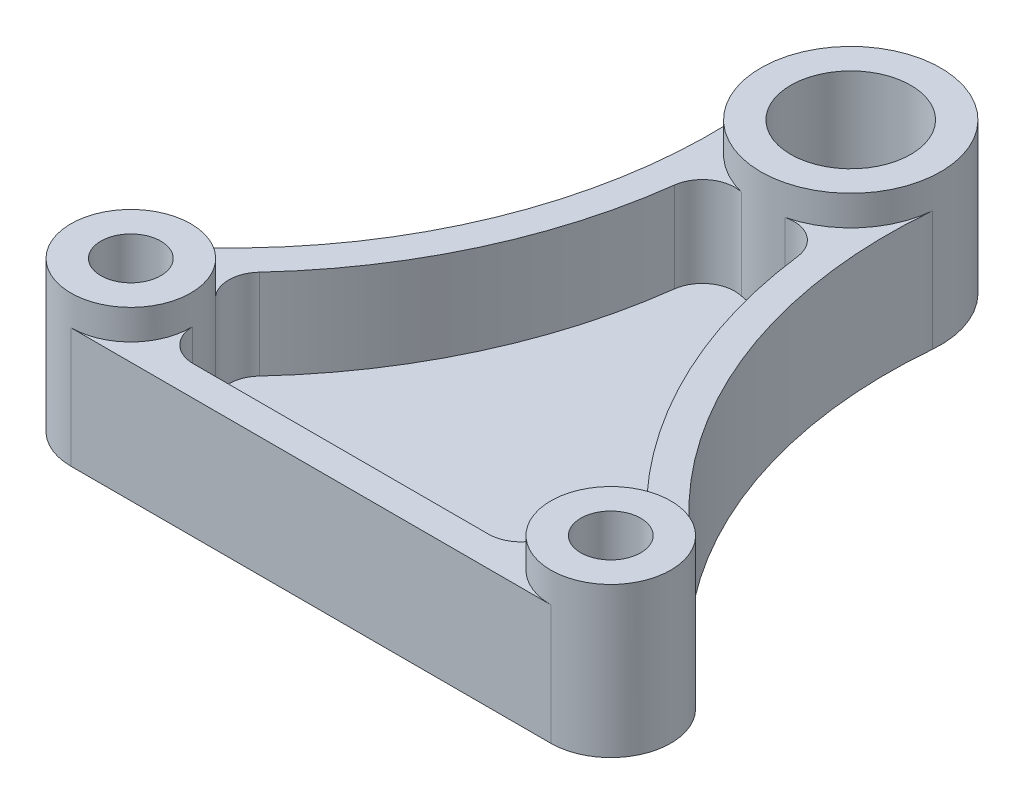
from build123d import *

# Parameters (mm, degrees)
BOSS_EXTRUDE1_DEPTH = 12.7
OUTSIDE_CIRLCES_R   = 9.525
OUTSIDE_CIRLCES_R_2 = 6.35
BOSS_EXTRUDE2_DEPTH = 15.875
SKETCH2_R           = 6.35
SKETCH2_R_2         = 3.175
CUT_EXTRUDE2_DEPTH  = 68.277043819
SHELL1_START        = 3.175
SHELL1_DEPTH        = 9.525
FILLET1_R           = 3.429


# Read off the part's stored shape, not the designer's step: Shell1
with BuildPart() as part:
    # Sketch1 → Boss-Extrude1 (new body)
    with BuildSketch(Plane(origin=(0, 0, 0), x_dir=(1, 0, 0), z_dir=(0, 1, 0))):
        with BuildLine():
            Line((-25.4, -57.15), (25.4, -57.15))
            ThreePointArc((25.4, -57.15), (31.415385717, -52.834117665), (29.253859008, -45.753192024))
            ThreePointArc((29.253859008, -45.753192024), (13.590190704, -25.845719106), (9.487062801, -0.849272876))
            ThreePointArc((9.487062801, -0.849272876), (0, 9.525), (-9.487062801, -0.849272876))
            ThreePointArc((-9.487062801, -0.849272876), (-13.590190704, -25.845719106), (-29.253859008, -45.753192024))
            ThreePointArc((-29.253859008, -45.753192024), (-31.415385717, -52.834117665), (-25.4, -57.15))
        make_face()
    extrude(amount=BOSS_EXTRUDE1_DEPTH)

    # Outside Cirlces → Boss-Extrude2 (add)
    with BuildSketch(Plane(origin=(0, 0, 0), x_dir=(1, 0, 0), z_dir=(0, 1, 0))):
        with Locations(Location((0, 0, 0), (0, 0, 354.884571445))):
            Circle(OUTSIDE_CIRLCES_R)
        with Locations(Location((25.4, -50.8, 0), (0, 0, 270))):
            Circle(OUTSIDE_CIRLCES_R_2)
        with Locations(Location((-25.4, -50.8, 0), (0, 0, 90))):
            Circle(OUTSIDE_CIRLCES_R_2)
    extrude(amount=BOSS_EXTRUDE2_DEPTH)

    # Sketch2 → Cut-Extrude2 (cut, through all)
    with BuildSketch(Plane(origin=(0, 0, 0), x_dir=(1, 0, 0), z_dir=(0, 1, 0))):
        with Locations(Location((0, 0, 0), (0, 0, 270))):
            Circle(SKETCH2_R)
        with Locations(Location((-25.4, -50.8, 0), (0, 0, 270))):
            Circle(SKETCH2_R_2)
        with Locations(Location((25.4, -50.8, 0), (0, 0, 270))):
            Circle(SKETCH2_R_2)
    extrude(amount=CUT_EXTRUDE2_DEPTH, mode=Mode.SUBTRACT)

    # Shell1 outline → Shell1 (cut)
    with BuildSketch(Plane(origin=(0, 0, 0), x_dir=(1, 0, 0), z_dir=(0, 1, 0)).offset(SHELL1_START)):
        with BuildLine():
            ThreePointArc((-23.245193613, -44.826783996), (-19.436053982, -48.61966794), (-19.900738686, -53.975))
            Line((-19.900738686, -53.975), (19.900738686, -53.975))
            ThreePointArc((19.900738686, -53.975), (19.436053982, -48.61966794), (23.245193613, -44.826783996))
            ThreePointArc((23.245193613, -44.826783996), (10.964919098, -27.751584466), (6.1431994, -7.279198179))
            ThreePointArc((6.1431994, -7.279198179), (0, -9.525), (-6.1431994, -7.279198179))
            ThreePointArc((-6.1431994, -7.279198179), (-10.964919098, -27.751584466), (-23.245193613, -44.826783996))
        make_face()
    extrude(amount=SHELL1_DEPTH, mode=Mode.SUBTRACT)

    # Fillet1
    fillet1_edges = [part.edges().sort_by_distance(p)[0] for p in [
        (-6.1431994, 7.9375, 7.279198179),
        (-19.900738686, 7.9375, 53.975),
        (23.245193613, 7.9375, 44.826783996),
        (6.1431994, 7.9375, 7.279198179),
        (-23.245193613, 7.9375, 44.826783996),
        (19.900738686, 7.9375, 53.975),
    ]]
    fillet(fillet1_edges, radius=FILLET1_R)


solid = part.part
